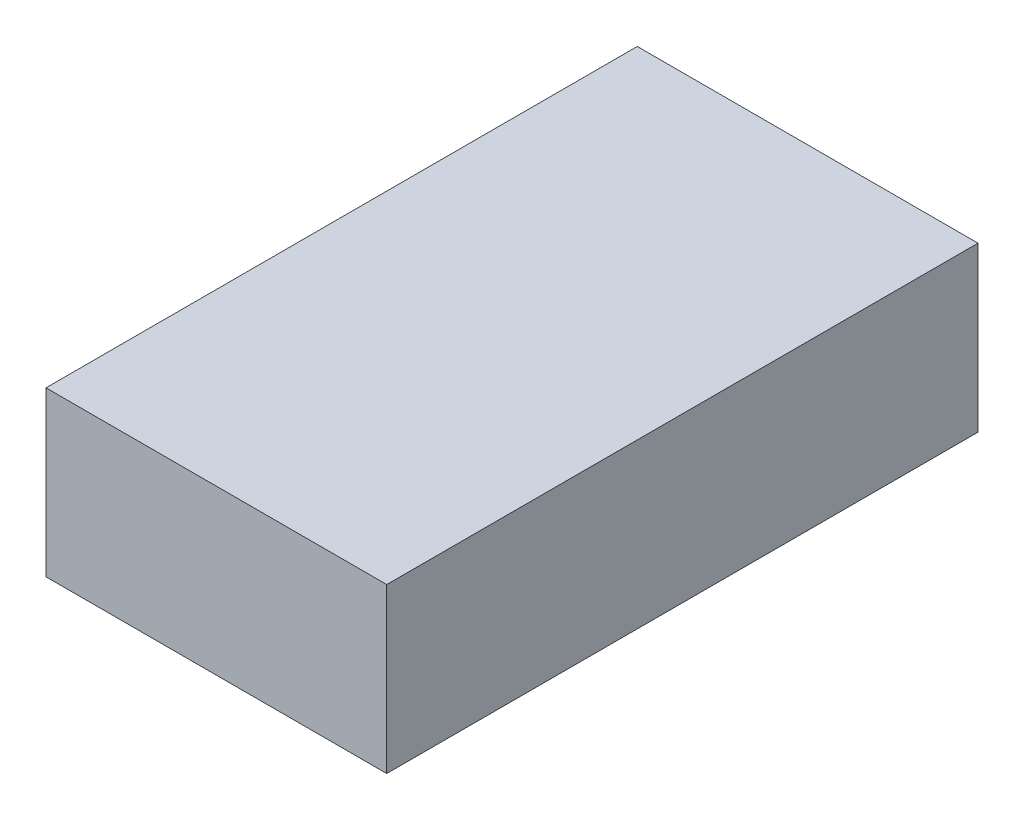
from build123d import *

# Parameters (mm, degrees)
SKETCH1_W           = 102
SKETCH1_H           = 177
BOSS_EXTRUDE1_DEPTH = 49


with BuildPart() as part:
    # Sketch1 → Boss-Extrude1 (new body)
    with BuildSketch(Plane(origin=(0, 0, 0), x_dir=(1, 0, 0), z_dir=(0, 1, 0))):
        Rectangle(SKETCH1_W, SKETCH1_H)
    extrude(amount=BOSS_EXTRUDE1_DEPTH)


solid = part.part
